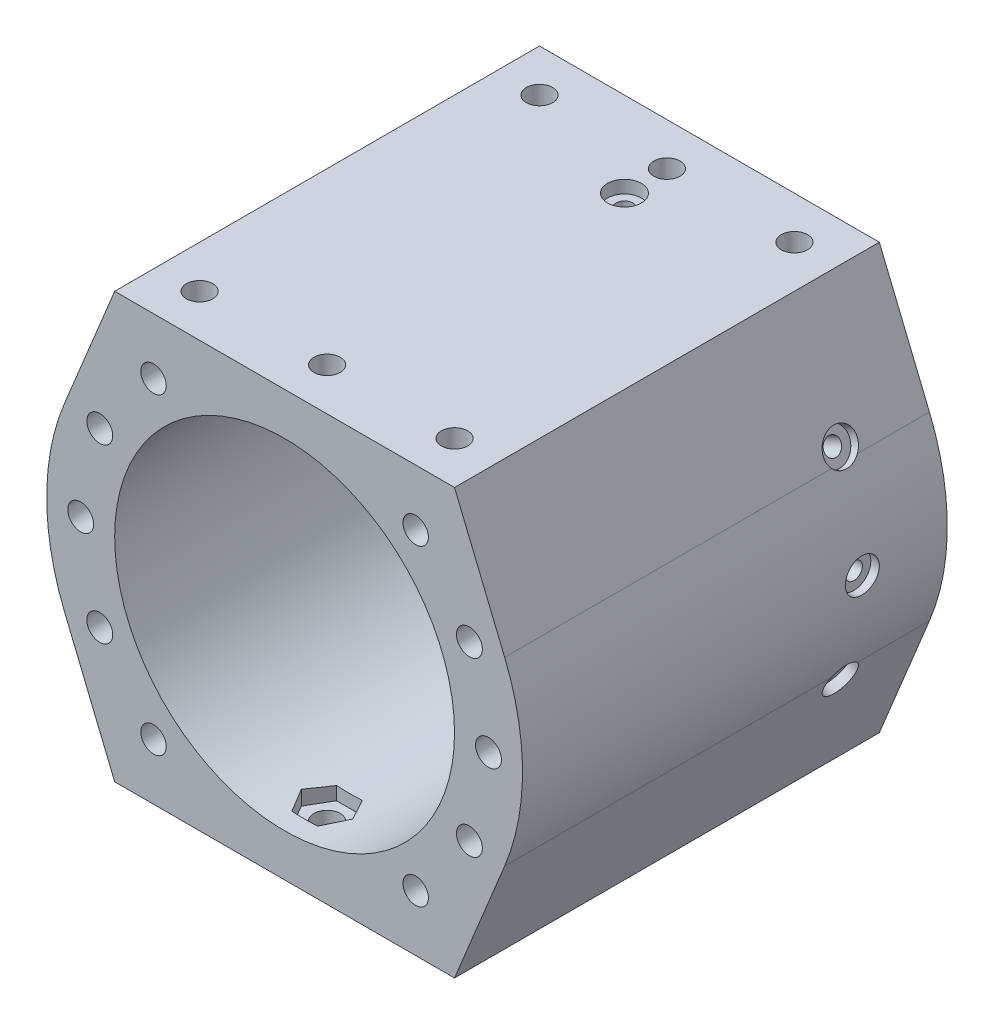
from build123d import *

# Parameters (mm, degrees)
SKETCH_1_R                       = 40
EXTRUDE_1_DEPTH                  = 100
SKETCH_2_R                       = 3.05
CUT_EXTRUDE_1_DEPTH              = 8
SKETCH_3_R                       = 3
CUT_EXTRUDE_2_DEPTH              = 100
CUT_EXTRUDE_3_REACH              = 160.253
SKETCH_4_R                       = 2
CUT_EXTRUDE_3_DIRECTION_2_DEPTH  = 3
SKETCH_5_R                       = 4
CUT_EXTRUDE_4_DEPTH              = 2
PATTERN_START                    = 39.94996861
PATTERN_CIRCULAR_1_OUTLINE_R     = 2
PATTERN_CIRCULAR_1_DEPTH         = 16.296886398
PATTERN_START_2                  = 54
PATTERN_CIRCULAR_1_2_OUTLINE_R   = 4
PATTERN_CIRCULAR_1_2_OUTLINE_R_2 = 2
PATTERN_CIRCULAR_1_2_DEPTH       = 2.246855008
PATTERN_CIRCULAR_1_3_OUTLINE_R   = 2
PATTERN_CIRCULAR_1_3_DEPTH       = 16.296886398
PATTERN_CIRCULAR_1_4_OUTLINE_R   = 4
PATTERN_CIRCULAR_1_4_OUTLINE_R_2 = 2
PATTERN_CIRCULAR_1_4_DEPTH       = 2.246855008
SKETCH_7_R                       = 2
CUT_EXTRUDE_5_DEPTH              = 153.105226841
SKETCH_8_R                       = 4
CUT_EXTRUDE_6_DEPTH              = 3
CUT_EXTRUDE_START                = -3
SKETCH_9_R                       = 4
CUT_EXTRUDE_7_DEPTH              = 3
SKETCH_10_R                      = 3.1
CUT_EXTRUDE_8_DEPTH              = 8
CUT_EXTRUDE_9_DEPTH              = 86


# Read off the part's stored shape, not the designer's step: Круговой массив1
with BuildPart() as part:
    # Эскиз1 → Бобышка-Вытянуть1 (new body)
    with BuildSketch(Plane.XY):
        with BuildLine():
            Line((40, 50), (-40, 50))
            Line((-40, 50), (-51.798872756, 21.280901795))
            ThreePointArc((-51.798872756, 21.280901795), (-56, 0), (-51.798872756, -21.280901795))
            Line((-51.798872756, -21.280901795), (-40, -50))
            Line((-40, -50), (40, -50))
            Line((40, -50), (51.798872756, -21.280901795))
            ThreePointArc((51.798872756, -21.280901795), (56, 0), (51.798872756, 21.280901795))
            Line((51.798872756, 21.280901795), (40, 50))
        make_face()
        Circle(SKETCH_1_R, mode=Mode.SUBTRACT)
    extrude(amount=EXTRUDE_1_DEPTH)

    # Эскиз2 → Вырез-Вытянуть1 (cut)
    with BuildSketch(Plane.XY.offset(100)):
        with Locations((-48, 0)):
            Circle(SKETCH_2_R)
        with Locations((-43.502773778, 20.285676564)):
            Circle(SKETCH_2_R)
        with Locations((-43.502773778, -20.285676564)):
            Circle(SKETCH_2_R)
        with Locations(Location((43.502773778, -20.285676564, 0), (0, 0, 180))):
            Circle(SKETCH_2_R)
        with Locations(Location((43.502773778, 20.285676564, 0), (0, 0, 180))):
            Circle(SKETCH_2_R)
        with Locations(Location((48, 0, 0), (0, 0, 180))):
            Circle(SKETCH_2_R)
    cut_extrude_1 = extrude(amount=-CUT_EXTRUDE_1_DEPTH, mode=Mode.SUBTRACT)

    # Зеркальное отражение1: Вырез-Вытянуть1 across plane
    add(cut_extrude_1.mirror(Plane.XY.offset(50)), mode=Mode.SUBTRACT)

    # Эскиз3 → Вырез-Вытянуть2 (cut)
    with BuildSketch(Plane.XY.offset(100)):
        with Locations((-30.853805265, 36.77013327)):
            Circle(SKETCH_3_R)
        with Locations((-30.853805265, -36.77013327)):
            Circle(SKETCH_3_R)
        with Locations((30.853805265, -36.77013327)):
            Circle(SKETCH_3_R)
        with Locations((30.853805265, 36.77013327)):
            Circle(SKETCH_3_R)
    extrude(amount=-CUT_EXTRUDE_2_DEPTH, mode=Mode.SUBTRACT)

    # Эскиз4 → Вырез-Вытянуть3 (cut, up to next)
    with BuildSketch(Plane(origin=(56, 0, 0), x_dir=(0, 0, -1), z_dir=(1, 0, 0)), mode=Mode.PRIVATE) as cut_extrude_3_sk1:
        with Locations(Location((-20, 0, 0), (0, 0, 180))):
            Circle(SKETCH_4_R)
    cut_extrude_3_tool1 = extrude(cut_extrude_3_sk1.sketch, amount=-CUT_EXTRUDE_3_REACH, mode=Mode.PRIVATE) & part.part
    cut_extrude_3 = cut_extrude_3_tool1.solids().sort_by_distance((56, 0, 20))[0]
    add(cut_extrude_3, mode=Mode.SUBTRACT)

    # Эскиз4 → Вырез-Вытянуть3 direction 2 (cut)
    with BuildSketch(Plane(origin=(56, 0, 0), x_dir=(0, 0, -1), z_dir=(1, 0, 0))):
        with Locations(Location((-20, 0, 0), (0, 0, 180))):
            Circle(SKETCH_4_R)
    cut_extrude_3_direction_2 = extrude(amount=CUT_EXTRUDE_3_DIRECTION_2_DEPTH, mode=Mode.SUBTRACT)

    # Эскиз5 → Вырез-Вытянуть4 (cut, symmetric)
    with BuildSketch(Plane(origin=(56, 0, 0), x_dir=(0, 0, -1), z_dir=(1, 0, 0))):
        with Locations(Location((-20, 0, 0), (0, 0, 180))):
            Circle(SKETCH_5_R)
    cut_extrude_4 = extrude(amount=CUT_EXTRUDE_4_DEPTH, both=True, mode=Mode.SUBTRACT)

    # Круговой массив1 outline → Круговой массив1 (cut)
    with BuildSketch(Plane(origin=(0, 0, 0), x_dir=(-0.4226182617407003, 0.9063077870366495, 0), z_dir=(0.9063077870366496, 0.4226182617407003, 0)).offset(PATTERN_START)):
        with Locations((0, 20)):
            Circle(PATTERN_CIRCULAR_1_OUTLINE_R)
    pattern_circular_1 = extrude(amount=PATTERN_CIRCULAR_1_DEPTH, mode=Mode.SUBTRACT)

    # Pattern Circular 1 2 outline → Pattern Circular 1 2 (cut)
    with BuildSketch(Plane(origin=(0, 0, 0), x_dir=(-0.4226182617407003, 0.9063077870366495, 0), z_dir=(0.9063077870366496, 0.4226182617407003, 0)).offset(PATTERN_START_2)):
        with Locations((0, 20)):
            Circle(PATTERN_CIRCULAR_1_2_OUTLINE_R)
        with Locations((0, 20)):
            Circle(PATTERN_CIRCULAR_1_2_OUTLINE_R_2, mode=Mode.SUBTRACT)
    pattern_circular_1_2 = extrude(amount=PATTERN_CIRCULAR_1_2_DEPTH, mode=Mode.SUBTRACT)

    # Pattern Circular 1 3 outline → Pattern Circular 1 3 (cut)
    with BuildSketch(Plane(origin=(0, 0, 0), x_dir=(0.4226182617407003, 0.9063077870366495, 0), z_dir=(0.9063077870366496, -0.4226182617407003, 0)).offset(PATTERN_START)):
        with Locations((0, 20)):
            Circle(PATTERN_CIRCULAR_1_3_OUTLINE_R)
    pattern_circular_1_3 = extrude(amount=PATTERN_CIRCULAR_1_3_DEPTH, mode=Mode.SUBTRACT)

    # Pattern Circular 1 4 outline → Pattern Circular 1 4 (cut)
    with BuildSketch(Plane(origin=(0, 0, 0), x_dir=(0.4226182617407003, 0.9063077870366495, 0), z_dir=(0.9063077870366496, -0.4226182617407003, 0)).offset(PATTERN_START_2)):
        with Locations((0, 20)):
            Circle(PATTERN_CIRCULAR_1_4_OUTLINE_R)
        with Locations((0, 20)):
            Circle(PATTERN_CIRCULAR_1_4_OUTLINE_R_2, mode=Mode.SUBTRACT)
    pattern_circular_1_4 = extrude(amount=PATTERN_CIRCULAR_1_4_DEPTH, mode=Mode.SUBTRACT)

    # Зеркальное отражение2: Вырез-Вытянуть3, Вырез-Вытянуть3 direction 2, Вырез-Вытянуть4, Круговой массив1, Pattern Circular 1 2, Pattern Circular 1 3, Pattern Circular 1 4 across plane
    add(cut_extrude_3.mirror(Plane.ZY), mode=Mode.SUBTRACT)
    add(cut_extrude_3_direction_2.mirror(Plane.ZY), mode=Mode.SUBTRACT)
    add(cut_extrude_4.mirror(Plane.ZY), mode=Mode.SUBTRACT)
    add(pattern_circular_1.mirror(Plane.ZY), mode=Mode.SUBTRACT)
    add(pattern_circular_1_2.mirror(Plane.ZY), mode=Mode.SUBTRACT)
    add(pattern_circular_1_3.mirror(Plane.ZY), mode=Mode.SUBTRACT)
    add(pattern_circular_1_4.mirror(Plane.ZY), mode=Mode.SUBTRACT)

    # Эскиз7 → Вырез-Вытянуть5 (cut, through all)
    with BuildSketch(Plane(origin=(0, 50, 0), x_dir=(1, 0, 0), z_dir=(0, 1, 0))):
        with Locations(Location((0, -20, 0), (0, 0, 180))):
            Circle(SKETCH_7_R)
    extrude(amount=-CUT_EXTRUDE_5_DEPTH, mode=Mode.SUBTRACT)

    # Эскиз8 → Вырез-Вытянуть6 (cut)
    with BuildSketch(Plane(origin=(0, 50, 0), x_dir=(1, 0, 0), z_dir=(0, 1, 0))):
        with Locations(Location((0, -20, 0), (0, 0, 180))):
            Circle(SKETCH_8_R)
    extrude(amount=-CUT_EXTRUDE_6_DEPTH, mode=Mode.SUBTRACT)

    # Эскиз9 → Вырез-Вытянуть7 (cut)
    with BuildSketch(Plane.XZ.offset(50).offset(CUT_EXTRUDE_START)):
        with Locations(Location((0, 20, 0), (0, 0, 180))):
            Circle(SKETCH_9_R)
    extrude(amount=CUT_EXTRUDE_7_DEPTH, mode=Mode.SUBTRACT)

    # Эскиз10 → Вырез-Вытянуть8 (cut)
    with BuildSketch(Plane(origin=(0, 50, 0), x_dir=(1, 0, 0), z_dir=(0, 1, 0))):
        with Locations(Location((-30, -10, 0), (0, 0, 180))):
            Circle(SKETCH_10_R)
        with Locations(Location((0, -10, 0), (0, 0, 180))):
            Circle(SKETCH_10_R)
        with Locations(Location((30, -10, 0), (0, 0, 180))):
            Circle(SKETCH_10_R)
        with Locations((30, -90)):
            Circle(SKETCH_10_R)
        with Locations((0, -90)):
            Circle(SKETCH_10_R)
        with Locations((-30, -90)):
            Circle(SKETCH_10_R)
    cut_extrude_8 = extrude(amount=-CUT_EXTRUDE_8_DEPTH, mode=Mode.SUBTRACT)

    # Зеркальное отражение3: Вырез-Вытянуть8 across plane
    add(cut_extrude_8.mirror(Plane.ZX), mode=Mode.SUBTRACT)

    # Эскиз12 → Вырез-Вытянуть9 (cut)
    with BuildSketch(Plane(origin=(0, 43, 0), x_dir=(1, 0, 0), z_dir=(0, 1, 0))):
        Polygon((-3.031088913, -4.75), (-6.062177826, -10), (-3.031088913, -15.25), (3.031088913, -15.25), (6.062177826, -10), (3.031088913, -4.75), align=None)
        Polygon((-3.031088913, -84.75), (-6.062177826, -90), (-3.031088913, -95.25), (3.031088913, -95.25), (6.062177826, -90), (3.031088913, -84.75), align=None)
    extrude(amount=-CUT_EXTRUDE_9_DEPTH, mode=Mode.SUBTRACT)


solid = part.part
